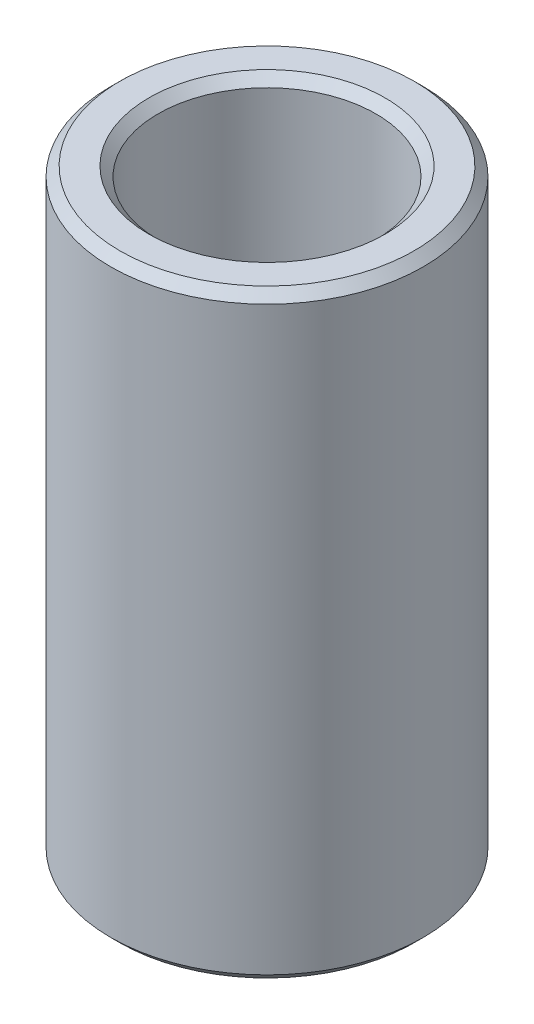
from build123d import *

# Parameters (mm, degrees)
SKETCH1_R           = 37.5
BOSS_EXTRUDE1_DEPTH = 143.82095349
SKETCH2_R           = 26.142012491
CUT_EXTRUDE1_DEPTH  = 154.287203193
CHAMFER1_SIZE       = 2.212619538


with BuildPart() as part:
    # Sketch1 → Boss-Extrude1 (new body)
    with BuildSketch(Plane(origin=(0, 0, 0), x_dir=(1, 0, 0), z_dir=(0, 1, 0))):
        Circle(SKETCH1_R)
    extrude(amount=BOSS_EXTRUDE1_DEPTH)

    # Sketch2 → Cut-Extrude1 (cut, through all)
    with BuildSketch(Plane(origin=(0, 0, 0), x_dir=(1, 0, 0), z_dir=(0, 1, 0))):
        Circle(SKETCH2_R)
    extrude(amount=CUT_EXTRUDE1_DEPTH, mode=Mode.SUBTRACT)

    # Chamfer1
    chamfer1_edges = [part.edges().sort_by_distance(p)[0] for p in [
        (-26.142012491, 143.82095349, 0),
        (-26.142012491, 0, 0),
        (-37.5, 0, 0),
        (-37.5, 143.82095349, 0),
    ]]
    chamfer(chamfer1_edges, length=CHAMFER1_SIZE)


solid = part.part
